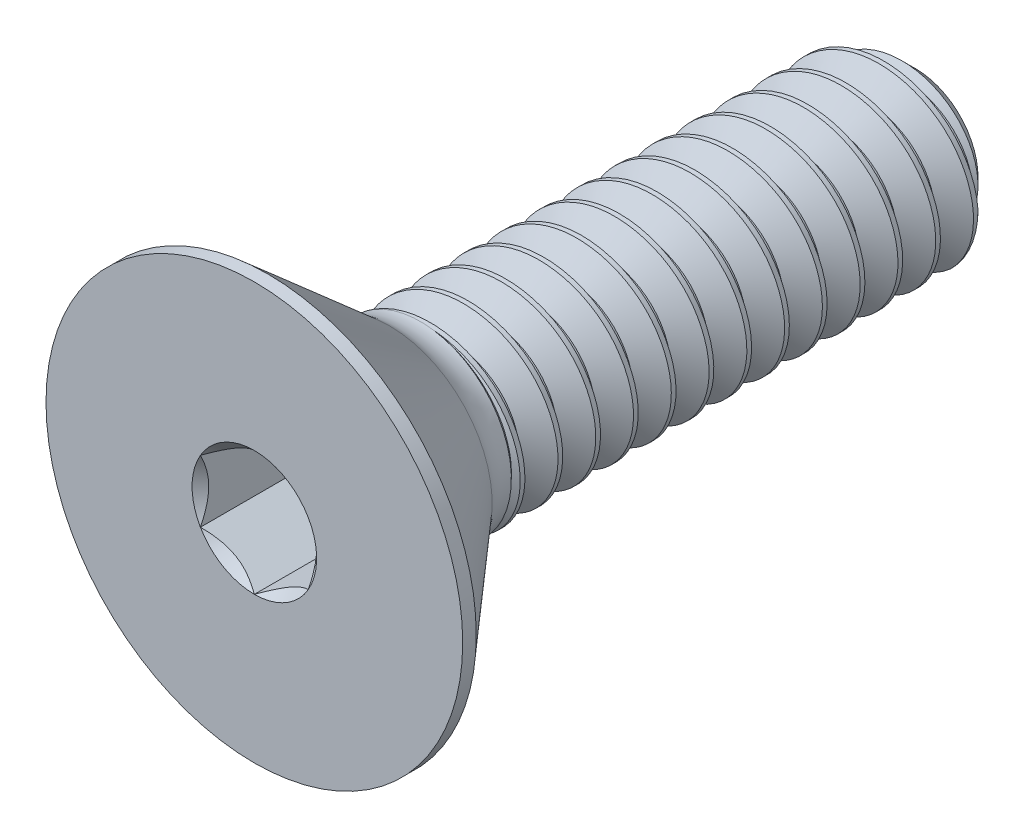
from build123d import *

# Parameters (mm, degrees)
SKETCH1_W          = 7.9375
SKETCH1_H          = 1.0922
CHAMFER1_SIZE      = 0.340178571
CUT_SWEEP1_PITCH   = 0.453571429
CUT_EXTRUDE2_DEPTH = 1.13792


with BuildPart() as part:
    # Sketch1 → Revolve1 (revolve)
    with BuildSketch(Plane(origin=(0, 0, 0), x_dir=(0, 0, -1), z_dir=(1, 0, 0))):
        with Locations((3.96875, 0.5461)):
            Rectangle(SKETCH1_W, SKETCH1_H)
    revolve(axis=Axis((0, 0, -7.9375), (0, 0, 1)))

    # Chamfer1
    chamfer1_edges = [part.edges().sort_by_distance(p)[0] for p in [
        (0, -1.0922, -7.9375),
    ]]
    chamfer(chamfer1_edges, length=CHAMFER1_SIZE)

    # Cut-Sweep1: arcs per turn and ends read off the stored shape
    # Cut-Sweep1: the profile of Sketch2 profile screwed along a right-hand helix through 18.666667 turns, 6 arcs to a turn; built about Z, then put on its axis
    cut_sweep1_z = Axis((0, 0, 0), (0, 0, 1))
    cut_sweep1_corners = [(1.0925, 0, 0.000173205), (1.0925, 0, -0.397048205), (0.797596715, 0, -0.226785714), (0.797596715, 0, -0.170089286)]
    with BuildLine(mode=Mode.PRIVATE) as cut_sweep1_profile:
        Line(cut_sweep1_corners[0], cut_sweep1_corners[1])
        Line(cut_sweep1_corners[1], cut_sweep1_corners[2])
        Line(cut_sweep1_corners[2], cut_sweep1_corners[3])
        Line(cut_sweep1_corners[3], cut_sweep1_corners[0])
    cut_sweep1_cap = Face(cut_sweep1_profile.wire())
    cut_sweep1_turn_angles = [0, 30, 60, 90, 120, 150, 180, 210, 240, 270, 300, 330, 360]
    cut_sweep1_turn_weights = [1, 0.8660254037844387, 1, 0.8660254037844387, 1, 0.8660254037844387, 1, 0.8660254037844387, 1, 0.8660254037844387, 1, 0.8660254037844387, 1]
    cut_sweep1_turn_rails = [Edge.make_bspline([Vector(p[0], p[1], 0).rotate(cut_sweep1_z, cut_sweep1_turn_angles[k]) / cut_sweep1_turn_weights[k] + Vector(0, 0, p[2] + CUT_SWEEP1_PITCH * cut_sweep1_turn_angles[k] / 360) for k in range(13)], [0, 0, 0, 1, 1, 2, 2, 3, 3, 4, 4, 5, 5, 6, 6, 6], 2, cut_sweep1_turn_weights) for p in cut_sweep1_corners]
    cut_sweep1_turn_sides = [Face.make_surface_from_curves(cut_sweep1_turn_rails[p[0]], cut_sweep1_turn_rails[p[1]]) for p in [(0, 1), (1, 2), (2, 3), (3, 0)]]
    cut_sweep1_last_angles = [6480, 6510, 6540, 6570, 6600, 6630, 6660, 6690, 6720]
    cut_sweep1_last_weights = [1, 0.8660254037844387, 1, 0.8660254037844387, 1, 0.8660254037844387, 1, 0.8660254037844387, 1]
    cut_sweep1_last_rails = [Edge.make_bspline([Vector(p[0], p[1], 0).rotate(cut_sweep1_z, cut_sweep1_last_angles[k]) / cut_sweep1_last_weights[k] + Vector(0, 0, p[2] + CUT_SWEEP1_PITCH * cut_sweep1_last_angles[k] / 360) for k in range(9)], [0, 0, 0, 1, 1, 2, 2, 3, 3, 4, 4, 4], 2, cut_sweep1_last_weights) for p in cut_sweep1_corners]
    cut_sweep1_last_sides = [Face.make_surface_from_curves(cut_sweep1_last_rails[p[0]], cut_sweep1_last_rails[p[1]]) for p in [(0, 1), (1, 2), (2, 3), (3, 0)]]
    cut_sweep1 = Plane(origin=(0, 0, -7.9375), x_dir=(0, 1, 0), z_dir=(0, 0, 1)) * Solid(Shell([*[p.moved(Location((0, 0, CUT_SWEEP1_PITCH * i))) for i in range(18) for p in cut_sweep1_turn_sides], *cut_sweep1_last_sides, cut_sweep1_cap, cut_sweep1_cap.rotate(cut_sweep1_z, 6720).moved(Location((0, 0, CUT_SWEEP1_PITCH * 6720 / 360)))]))
    add(cut_sweep1, mode=Mode.SUBTRACT)

    # Sketch7 → Revolve2 (revolve)
    with BuildSketch(Plane(origin=(0, 0, 0), x_dir=(0, 0, -1), z_dir=(1, 0, 0)), mode=Mode.PRIVATE) as revolve2_sk:
        with BuildLine():
            Line((0, 2.5019), (0.16256, 2.5019))
            Line((0.16256, 2.5019), (1.6256, 1.230098731))
            ThreePointArc((1.6256, 1.230098731), (1.797545379, 1.127801981), (1.99442691, 1.0922))
            Line((1.99442691, 1.0922), (1.99442691, 0))
            Line((1.99442691, 0), (0, 0))
            Line((0, 0), (0, 2.5019))
        make_face()
    revolve(revolve2_sk.sketch.rotate(Axis((0, 0, 0), (0, 0, -1)), 189.336081704), axis=Axis((0, 0, 0), (0, 0, -1)))

    # Boss-Extrude1 cone 1 section (through the dimple's axis) → Boss-Extrude1 (revolve)
    with BuildSketch(Plane(origin=(0, 0, -1.99442691), x_dir=(0, -1, 0), z_dir=(1, 0, 0))):
        Polygon((0, 0), (1.0922, 0), (0, 1.0922), align=None)
    revolve(axis=Axis((0, 0, -1.99442691), (0, 0, -1)))

    # Sketch5 → Cut-Extrude2 (cut)
    with BuildSketch(Plane.XY):
        Polygon((0.6477, -0.373949769), (0.6477, 0.373949769), (0, 0.747899539), (-0.6477, 0.373949769), (-0.6477, -0.373949769), (0, -0.747899539), align=None)
    extrude(amount=-CUT_EXTRUDE2_DEPTH, mode=Mode.SUBTRACT)

    # Cut-Extrude3 cone 1 section (through the dimple's axis) → Cut-Extrude3 (revolve, cut)
    with BuildSketch(Plane(origin=(0, 0, 0), x_dir=(0, -1, 0), z_dir=(1, 0, 0))):
        Polygon((0, 0), (0.747899539, 0), (0, 0.747899539), align=None)
    revolve(axis=Axis((0, 0, 0), (0, 0, -1)), mode=Mode.SUBTRACT)


solid = part.part
